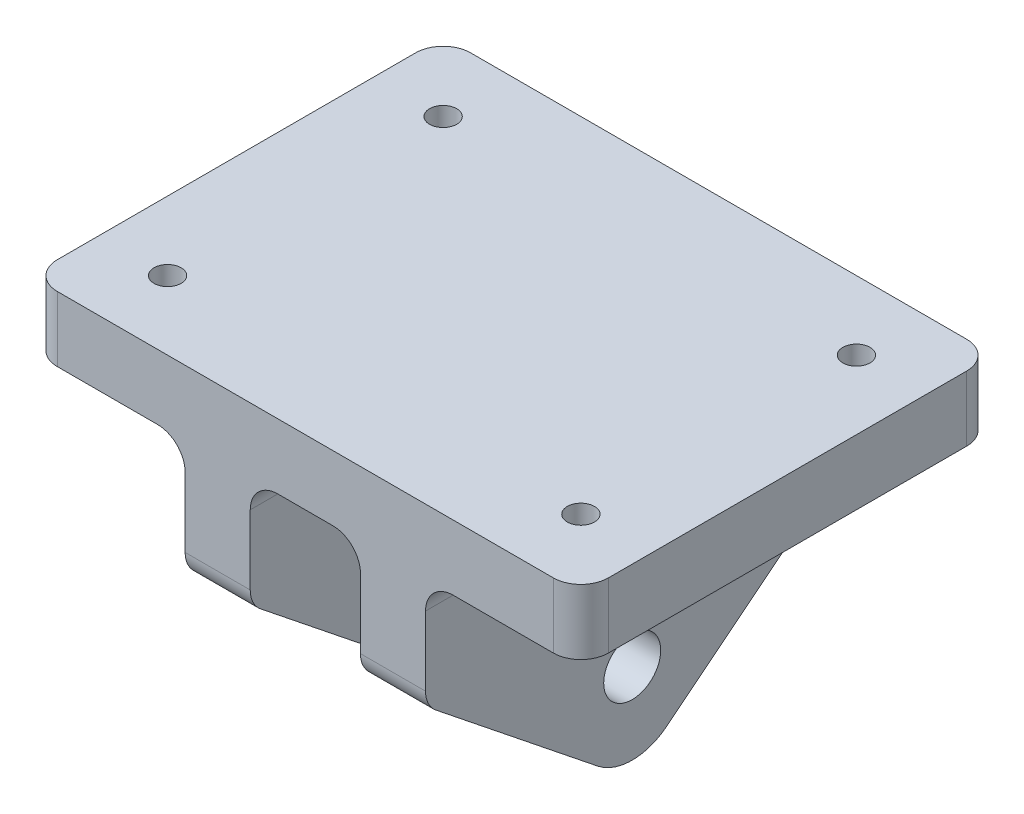
from build123d import *
from OCP.BRepFilletAPI import BRepFilletAPI_MakeFillet

# Parameters (mm, degrees)
SKETCH1_R           = 2.627
BOSS_EXTRUDE1_DEPTH = 6
BOSS_EXTRUDE2_START = -5.08
SKETCH1_3_W         = 38.1
SKETCH1_3_H         = 5.999999938
BOSS_EXTRUDE2_DEPTH = 25.4
SKETCH3_R           = 1.25
CUT_EXTRUDE1_DEPTH  = 45.654479015
FILLET1_R1          = 2.54
FILLET1_R2          = 5.08
SKETCH4_R           = 4.2145
SKETCH4_R_2         = 2.627
BOSS_EXTRUDE3_DEPTH = 2.54
BOSS_EXTRUDE4_START = 7.62
SKETCH4_2_R         = 4.2145
SKETCH4_2_R_2       = 2.627
BOSS_EXTRUDE4_DEPTH = 2.54
CHAMFER2_SIZE       = 2.54


with BuildPart() as part:
    # Sketch1 → Boss-Extrude1 (new body)
    with BuildSketch(Plane(origin=(5.08, 0, 0), x_dir=(0, 0, -1), z_dir=(1, 0, 0))):
        Polygon((-19.05, 0), (-19.05, -10.16), (0, -25.4), (19.05, -10.16), (19.05, 0), align=None)
        with Locations((0, -16.51)):
            Circle(SKETCH1_R, mode=Mode.SUBTRACT)
    boss_extrude1 = extrude(amount=BOSS_EXTRUDE1_DEPTH)

    # Sketch1<3> → Boss-Extrude2 (add)
    with BuildSketch(Plane(origin=(5.08, 0, 0), x_dir=(0, 0, -1), z_dir=(1, 0, 0)).offset(BOSS_EXTRUDE2_START)):
        with Locations((0, 2.999999969)):
            Rectangle(SKETCH1_3_W, SKETCH1_3_H)
    boss_extrude2 = extrude(amount=BOSS_EXTRUDE2_DEPTH)

    # Sketch3 → Cut-Extrude1 (cut, through all)
    with BuildSketch(Plane(origin=(0, 5.999999938, 0), x_dir=(1, 0, 0), z_dir=(0, 1, 0))):
        with Locations(Location((19.05, 12.7, 0), (0, 0, 270))):
            Circle(SKETCH3_R)
        with Locations(Location((19.05, -12.7, 0), (0, 0, 90))):
            Circle(SKETCH3_R)
    cut_extrude1 = extrude(amount=-CUT_EXTRUDE1_DEPTH, mode=Mode.SUBTRACT)

    # Mirror2: Boss-Extrude2, Cut-Extrude1 across plane
    add(boss_extrude2.mirror(Plane(origin=(0, 0, 0), x_dir=(0, 0, 1), z_dir=(1, 0, 0))))
    add(cut_extrude1.mirror(Plane(origin=(0, 0, 0), x_dir=(0, 0, 1), z_dir=(1, 0, 0))), mode=Mode.SUBTRACT)

    # Mirror3: Boss-Extrude1 across plane
    add(boss_extrude1.mirror(Plane(origin=(0, 0, 0), x_dir=(0, 0, 1), z_dir=(1, 0, 0))))

    # Fillet1: one fillet with a radius per group of edges: ONE call of the kernel's fillet builder (fillet() takes one radius for all edges)
    fillet1_edges_1 = [part.edges().sort_by_distance(p)[0] for p in [
        (8.08, -10.16, 19.05),
        (8.08, -10.16, -19.05),
        (11.08, 0, 0),
        (25.4, 2.999999969, 19.05),
        (25.4, 2.999999969, -19.05),
        (-25.4, 2.999999969, -19.05),
        (-25.4, 2.999999969, 19.05),
        (-8.08, -10.16, -19.05),
        (-8.08, -10.16, 19.05),
        (-5.08, 0, 0),
        (-11.08, 0, 0),
        (5.08, 0, 0),
    ]]
    fillet1_edges_2 = [part.edges().sort_by_distance(p)[0] for p in [
        (8.08, -25.4, 0),
        (-8.08, -25.4, 0),
    ]]
    fillet1 = BRepFilletAPI_MakeFillet(part.part.solid().wrapped)
    for e in fillet1_edges_1:
        fillet1.Add(FILLET1_R1, e.wrapped)
    for e in fillet1_edges_2:
        fillet1.Add(FILLET1_R2, e.wrapped)
    add(Compound.cast(fillet1.Shape()), mode=Mode.REPLACE)

    # Sketch4 → Boss-Extrude3 (add)
    with BuildSketch(Plane.ZY.offset(-5.08)):
        with Locations(Location((0, -16.51, 0), (0, 0, 180))):
            Circle(SKETCH4_R)
        with Locations((0, -16.51)):
            Circle(SKETCH4_R_2, mode=Mode.SUBTRACT)
    extrude(amount=BOSS_EXTRUDE3_DEPTH)

    # Sketch4<2> → Boss-Extrude4 (add)
    with BuildSketch(Plane.ZY.offset(-5.08).offset(BOSS_EXTRUDE4_START)):
        with Locations(Location((0, -16.51, 0), (0, 0, 180))):
            Circle(SKETCH4_2_R)
        with Locations((0, -16.51)):
            Circle(SKETCH4_2_R_2, mode=Mode.SUBTRACT)
    extrude(amount=BOSS_EXTRUDE4_DEPTH)

    # Chamfer2
    chamfer2_edges = [part.edges().sort_by_distance(p)[0] for p in [
        (5.08, -16.51, 4.2145),
        (-5.08, -16.51, 4.2145),
    ]]
    chamfer(chamfer2_edges, length=CHAMFER2_SIZE - 0.0001)  # a hair under: the kernel refuses the full size


solid = part.part
